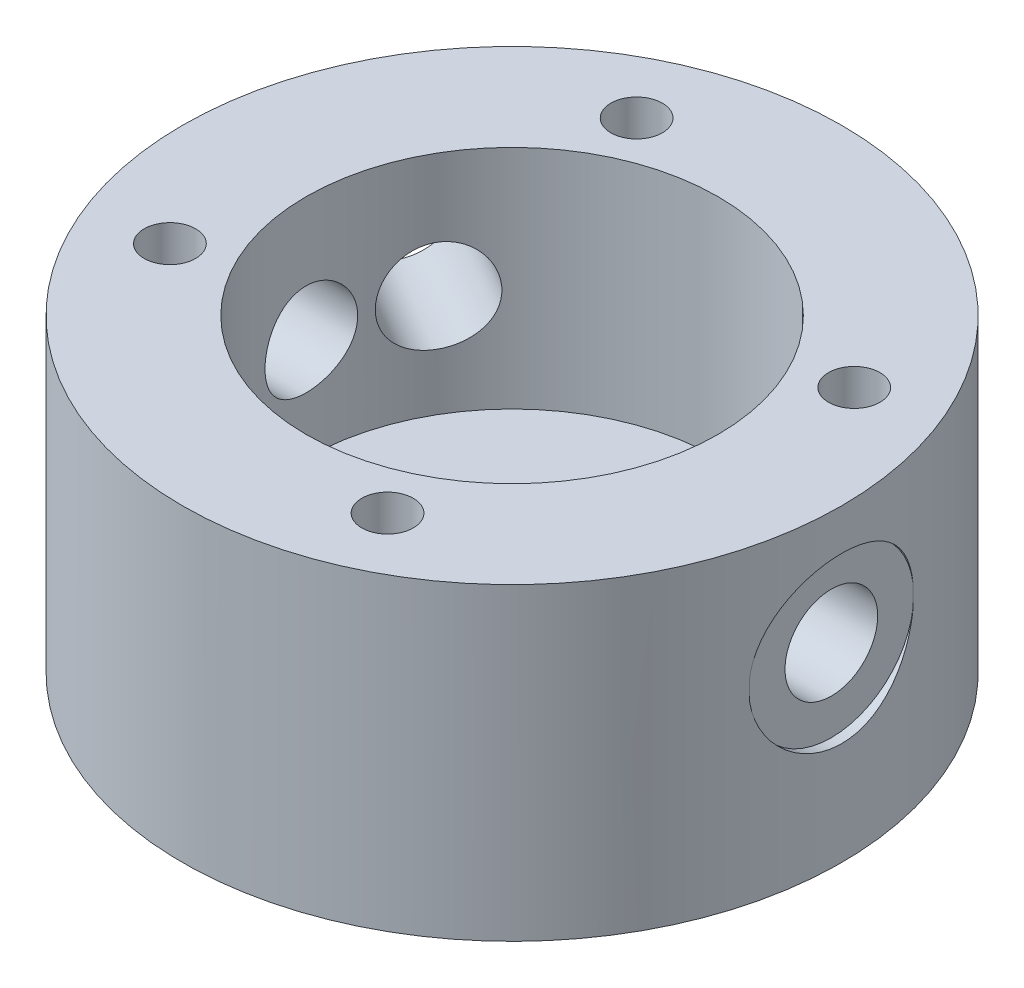
from build123d import *

# Parameters (mm, degrees)
ESBO_O4_W                        = 2.25
ESBO_O4_H                        = 16
F_4_5_4_5_DIAMETER_HOLE2_D       = 4.5
F_4_5_4_5_DIAMETER_HOLE2_DEPTH   = 18
F_4_5_4_5_DIAMETER_HOLE2_TIP     = 1.351936393
ESBO_O12_R                       = 16
ESBO_O12_R_2                     = 9
RESSALTO_EXTRUS_O1_DEPTH         = 1
CHANFRO1_SIZE                    = 0.5
CHANFRO2_SIZE                    = 0.25
FURO_DE_DI_METRO_4_5_4_5_2_D     = 4.5
FURO_DE_DI_METRO_4_5_4_5_2_DEPTH = 8
FURO_DE_DI_METRO_4_5_4_5_2_TIP   = 1.351936393
CORTE_EXTRUS_O4_START            = -0.5
ESBO_O18_R                       = 4
ESBO_O18_R_2                     = 2.25
CORTE_EXTRUS_O4_DEPTH            = 0.5
PADR_OCIRCULAR6_COUNT            = 2
PADR_OCIRCULAR6_ANGLE            = 30
PADR_OCIRCULAR7_COUNT            = 2
PADR_OCIRCULAR7_ANGLE            = 210
REBAIXO_INSERTO_REACH            = 29.148
ESBO_O20_R                       = 10


# Read off the part's stored shape, not the designer's step: PadrãoCircular5
with BuildPart() as part:
    # Esboço1 → Revolução1 (revolve)
    with BuildSketch(Plane.XY, mode=Mode.PRIVATE) as revolu_o1_sk:
        Polygon((3, -9), (16, -9), (16, 5), (9, 5), (9, -5), (3, -5), align=None)
    revolve(revolu_o1_sk.sketch.rotate(Axis((0, -9, 0), (0, 1, 0)), 90), axis=Axis((0, -9, 0), (0, 1, 0)))

    # Esboço4 → Furo de diâmetro Ø4.5 (4.5)1 (revolve, cut)
    with BuildSketch(Plane(origin=(16, 0, 0), x_dir=(0, 0, -1), z_dir=(0, 1, 0))):
        with Locations((1.125, 8)):
            Rectangle(ESBO_O4_W, ESBO_O4_H)
    revolve(axis=Axis((22.35, 0, 0), (-1, 0, 0)), mode=Mode.SUBTRACT)

    # Ø4.5 (4.5) Diameter Hole2
    with Locations(Plane(origin=(-13.856406461, 0, -8), x_dir=(0, -1, 0), z_dir=(-0.8660254037844364, 0, -0.5000000000000041))):
        with Locations((0, 0)):
            Hole(F_4_5_4_5_DIAMETER_HOLE2_D / 2, depth=F_4_5_4_5_DIAMETER_HOLE2_DEPTH)
            with Locations((0, 0, -(F_4_5_4_5_DIAMETER_HOLE2_DEPTH + F_4_5_4_5_DIAMETER_HOLE2_TIP / 2))):  # 118° drill point
                Cone(0, F_4_5_4_5_DIAMETER_HOLE2_D / 2, F_4_5_4_5_DIAMETER_HOLE2_TIP, mode=Mode.SUBTRACT)

    # Esboço12 → Ressalto-extrusão1 (add)
    with BuildSketch(Plane(origin=(0, 5, 0), x_dir=(1, 0, 0), z_dir=(0, 1, 0))):
        with Locations(Location((0, 0, 0), (0, 0, 90))):
            Circle(ESBO_O12_R)
        with Locations(Location((0, 0, 0), (0, 0, 90))):
            Circle(ESBO_O12_R_2, mode=Mode.SUBTRACT)
    extrude(amount=RESSALTO_EXTRUS_O1_DEPTH)

    # Esboço13 → Furo roscado de M3x0.51 (revolve, cut)
    with BuildSketch(Plane(origin=(11.328847338, 6, -5.282728272), x_dir=(0, 0, 1), z_dir=(1, 0, 0))):
        Polygon((0, 0), (0, 10.751075774), (1.25, 10), (1.25, 0), align=None)
    revolve(axis=Axis((11.328847338, 12.35, -5.282728272), (0, -1, 0)), mode=Mode.SUBTRACT)

    # PadrãoCircular5 outline → PadrãoCircular5 (revolve, cut)
    with BuildSketch(Plane(origin=(5.282728272, 0, 11.328847338), x_dir=(1, 0, 0), z_dir=(0, 0, 1))):
        Polygon((0, 6), (0, -4.751075774), (1.25, -4), (1.25, 6), align=None)
    revolve(axis=Axis((5.282728272, 0, 11.328847338), (0, 1, 0)), mode=Mode.SUBTRACT)

    # Padr_oCircular5 2 outline → Padr_oCircular5 2 (revolve, cut)
    with BuildSketch(Plane(origin=(-11.328847338, 0, 5.282728272), x_dir=(1, 0, 0), z_dir=(0, 0, 1))):
        Polygon((0, 6), (0, -4.751075774), (1.25, -4), (1.25, 6), align=None)
    revolve(axis=Axis((-11.328847338, 0, 5.282728272), (0, 1, 0)), mode=Mode.SUBTRACT)

    # Padr_oCircular5 3 outline → Padr_oCircular5 3 (revolve, cut)
    with BuildSketch(Plane(origin=(-5.282728272, 0, -11.328847338), x_dir=(1, 0, 0), z_dir=(0, 0, 1))):
        Polygon((0, 6), (0, -4.751075774), (1.25, -4), (1.25, 6), align=None)
    revolve(axis=Axis((-5.282728272, 0, -11.328847338), (0, 1, 0)), mode=Mode.SUBTRACT)

    # Chanfro1
    chanfro1_edges = [part.edges().sort_by_distance(p)[0] for p in [
        (0, -5, 3),
    ]]
    chamfer(chanfro1_edges, length=CHANFRO1_SIZE)

    # Chanfro2
    chanfro2_edges = [part.edges().sort_by_distance(p)[0] for p in [
        (0, 6, 9),
    ]]
    chamfer(chanfro2_edges, length=CHANFRO2_SIZE)

    # Furo de diâmetro Ø4.5 (4.5)2
    with Locations(Plane(origin=(-16, 0, 0), x_dir=(0, 0, -1), z_dir=(-1, 0, 0))):
        with Locations((0, 0)):
            Hole(FURO_DE_DI_METRO_4_5_4_5_2_D / 2, depth=FURO_DE_DI_METRO_4_5_4_5_2_DEPTH)
            with Locations((0, 0, -(FURO_DE_DI_METRO_4_5_4_5_2_DEPTH + FURO_DE_DI_METRO_4_5_4_5_2_TIP / 2))):  # 118° drill point
                Cone(0, FURO_DE_DI_METRO_4_5_4_5_2_D / 2, FURO_DE_DI_METRO_4_5_4_5_2_TIP, mode=Mode.SUBTRACT)

    # Esboço18 → Corte-extrusão4 (cut)
    with BuildSketch(Plane(origin=(-13.856406461, 0, -8), x_dir=(0, -1, 0), z_dir=(-0.8660254037844364, 0, -0.5000000000000041)).offset(CORTE_EXTRUS_O4_START)):
        Circle(ESBO_O18_R)
        with Locations(Location((0, 0, 0), (0, 0, 90))):
            Circle(ESBO_O18_R_2, mode=Mode.SUBTRACT)
    corte_extrus_o4 = extrude(amount=CORTE_EXTRUS_O4_DEPTH, mode=Mode.SUBTRACT)

    # PadrãoCircular6: Corte-extrusão4 ×2 about axis
    padr_ocircular6_axis = Axis((0, -9.75, 0), (0, 1, 0))
    for i in range(1, PADR_OCIRCULAR6_COUNT):
        add(corte_extrus_o4.rotate(padr_ocircular6_axis, i * PADR_OCIRCULAR6_ANGLE / (PADR_OCIRCULAR6_COUNT - 1)), mode=Mode.SUBTRACT)

    # PadrãoCircular7: Corte-extrusão4 ×2 about axis
    padr_ocircular7_axis = Axis((0, -9.75, 0), (0, 1, 0))
    for i in range(1, PADR_OCIRCULAR7_COUNT):
        add(corte_extrus_o4.rotate(padr_ocircular7_axis, i * PADR_OCIRCULAR7_ANGLE / (PADR_OCIRCULAR7_COUNT - 1)), mode=Mode.SUBTRACT)

    # Rebaixo_Inserto: up to this face of the body (flat: up to its plane)
    rebaixo_inserto_end = Plane(part.part.faces().sort_by_distance((0, -5, 3.754558441))[0])
    # Esboço20 → Rebaixo_Inserto (cut, up to the picked face)
    with BuildSketch(Plane(origin=(0, 6, 0), x_dir=(1, 0, 0), z_dir=(0, 1, 0)), mode=Mode.PRIVATE) as rebaixo_inserto_sk1:
        with Locations(Location((0, 0, 0), (0, 0, 270))):
            Circle(ESBO_O20_R)
    rebaixo_inserto_tool1 = split(extrude(rebaixo_inserto_sk1.sketch, amount=-REBAIXO_INSERTO_REACH, mode=Mode.PRIVATE), bisect_by=rebaixo_inserto_end, keep=Keep.BOTH, mode=Mode.PRIVATE)
    add(rebaixo_inserto_tool1.solids().sort_by(Axis((0, 6, 0), (0, -1, 0)))[0], mode=Mode.SUBTRACT)


solid = part.part
